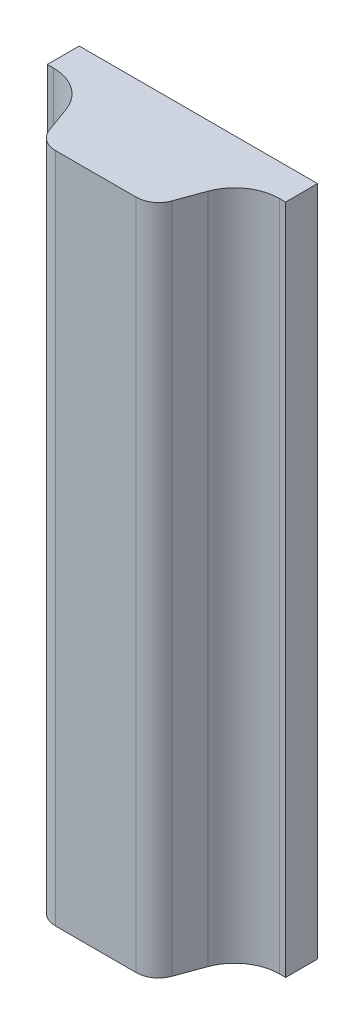
from build123d import *

# Parameters (mm, degrees)
EXTRUDE_1_DEPTH = 6


with BuildPart() as part:
    # 草图1 → 凸台-拉伸1 (new body)
    with BuildSketch(Plane(origin=(0, 0, 0), x_dir=(1, 0, 0), z_dir=(0, 1, 0))):
        with BuildLine():
            Line((4.181064308, -0.346153929), (4.266632429, -0.111057449))
            ThreePointArc((4.266632429, -0.111057449), (4.413078903, 0.079795311), (4.642509478, 0.152134494))
            Line((4.642509478, 0.152134494), (4.697815899, 0.152134494))
            Line((4.697815899, 0.152134494), (4.697815899, 0.43758725))
            Line((4.697815899, 0.43758725), (2.568518685, 0.43758725))
            Line((2.568518685, 0.43758725), (2.568518685, 0.152134494))
            Line((2.568518685, 0.152134494), (2.623825106, 0.152134494))
            ThreePointArc((2.623825106, 0.152134494), (2.853255681, 0.079795311), (2.999702154, -0.111057449))
            Line((2.999702154, -0.111057449), (3.085270275, -0.346153929))
            ThreePointArc((3.085270275, -0.346153929), (3.158493512, -0.441580309), (3.273208799, -0.477749901))
            Line((3.273208799, -0.477749901), (3.993125784, -0.477749901))
            ThreePointArc((3.993125784, -0.477749901), (4.107841071, -0.441580309), (4.181064308, -0.346153929))
        make_face()
    extrude(amount=EXTRUDE_1_DEPTH)


solid = part.part
